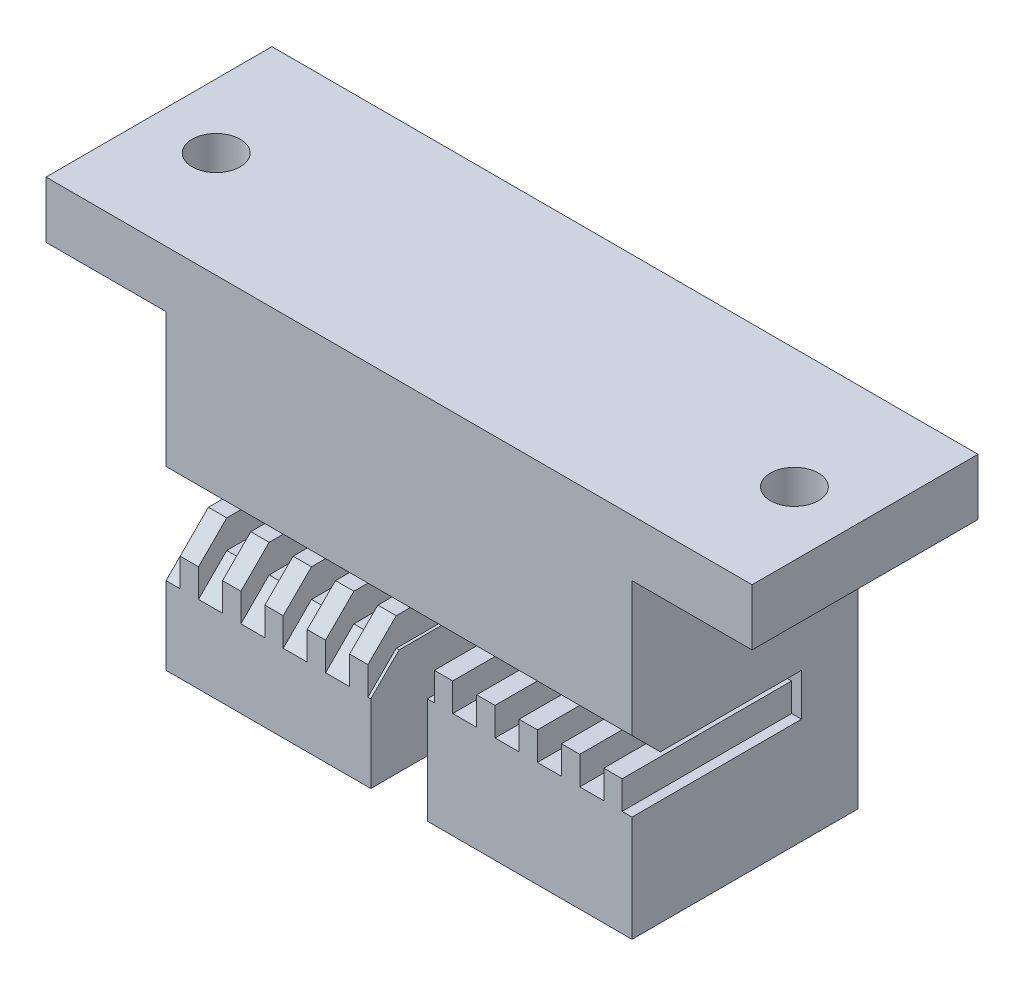
from build123d import *

# Parameters (mm, degrees)
SKETCH1_W            = 50
SKETCH1_H            = 26
BOSS_EXTRUDE1_DEPTH  = 16
SKETCH2_W            = 8.5
SKETCH2_H            = 22
CUT_EXTRUDE1_DEPTH   = 59.583274064
SKETCH3_W            = 8.5
SKETCH3_H            = 22
CUT_EXTRUDE2_DEPTH   = 59.583274064
SKETCH4_W            = 12
SKETCH4_H            = 10.5
CUT_EXTRUDE3_DEPTH   = 52.217672731
SKETCH5_W            = 14.5
SKETCH5_H            = 7.5
BOSS_EXTRUDE2_DEPTH  = 12
SKETCH6_W            = 1.3
SKETCH6_H            = 2
BOSS_EXTRUDE3_DEPTH  = 12
SKETCH7_W            = 1.3
SKETCH7_H            = 2
BOSS_EXTRUDE4_DEPTH  = 12
SKETCH8_W            = 1.3
SKETCH8_H            = 2
BOSS_EXTRUDE5_DEPTH  = 12
SKETCH9_W            = 1.3
SKETCH9_H            = 2
BOSS_EXTRUDE6_DEPTH  = 12
SKETCH10_W           = 1.3
SKETCH10_H           = 2
BOSS_EXTRUDE7_DEPTH  = 12
SKETCH11_W           = 14.5
SKETCH11_H           = 7.5
BOSS_EXTRUDE8_DEPTH  = 12
SKETCH12_W           = 1.3
SKETCH12_H           = 2
BOSS_EXTRUDE9_DEPTH  = 12
SKETCH13_W           = 1.3
SKETCH13_H           = 2
BOSS_EXTRUDE10_DEPTH = 12
SKETCH14_W           = 1.3
SKETCH14_H           = 2
BOSS_EXTRUDE11_DEPTH = 12
SKETCH15_W           = 1.3
SKETCH15_H           = 2
BOSS_EXTRUDE12_DEPTH = 12
SKETCH16_W           = 1.3
SKETCH16_H           = 2
BOSS_EXTRUDE13_DEPTH = 12
SKETCH17_R           = 1.7
CUT_EXTRUDE4_DEPTH   = 59.318093247
SKETCH18_R           = 1.7
CUT_EXTRUDE5_DEPTH   = 59.318093247
CHAMFER2_SIZE        = 2


with BuildPart() as part:
    # Sketch1 → Boss-Extrude1 (new body)
    with BuildSketch(Plane(origin=(0, 0, -1), x_dir=(-1, 0, 0), z_dir=(0, 0, -1))):
        with Locations((25, 13)):
            Rectangle(SKETCH1_W, SKETCH1_H)
    extrude(amount=-BOSS_EXTRUDE1_DEPTH)

    # Sketch2 → Cut-Extrude1 (cut, through all)
    with BuildSketch(Plane(origin=(0, 0, -1), x_dir=(-1, 0, 0), z_dir=(0, 0, -1))):
        with Locations((45.75, 11)):
            Rectangle(SKETCH2_W, SKETCH2_H)
    extrude(amount=-CUT_EXTRUDE1_DEPTH, mode=Mode.SUBTRACT)

    # Sketch3 → Cut-Extrude2 (cut, through all)
    with BuildSketch(Plane(origin=(0, 0, -1), x_dir=(-1, 0, 0), z_dir=(0, 0, -1))):
        with Locations((4.25, 11)):
            Rectangle(SKETCH3_W, SKETCH3_H)
    extrude(amount=-CUT_EXTRUDE2_DEPTH, mode=Mode.SUBTRACT)

    # Sketch4 → Cut-Extrude3 (cut, through all)
    with BuildSketch(Plane.ZY.offset(41.5)):
        with Locations((9, 5.25)):
            Rectangle(SKETCH4_W, SKETCH4_H)
    extrude(amount=-CUT_EXTRUDE3_DEPTH, mode=Mode.SUBTRACT)

    # Sketch5 → Boss-Extrude2 (add)
    with BuildSketch(Plane.XY.offset(3)):
        with Locations((-15.75, 3.75)):
            Rectangle(SKETCH5_W, SKETCH5_H)
    extrude(amount=BOSS_EXTRUDE2_DEPTH)

    # Sketch6 → Boss-Extrude3 (add)
    with BuildSketch(Plane.XY.offset(3)):
        with Locations((-9.85, 8.5)):
            Rectangle(SKETCH6_W, SKETCH6_H)
    extrude(amount=BOSS_EXTRUDE3_DEPTH)

    # Sketch7 → Boss-Extrude4 (add)
    with BuildSketch(Plane.XY.offset(3)):
        with Locations((-12.85, 8.5)):
            Rectangle(SKETCH7_W, SKETCH7_H)
    extrude(amount=BOSS_EXTRUDE4_DEPTH)

    # Sketch8 → Boss-Extrude5 (add)
    with BuildSketch(Plane.XY.offset(3)):
        with Locations((-15.85, 8.5)):
            Rectangle(SKETCH8_W, SKETCH8_H)
    extrude(amount=BOSS_EXTRUDE5_DEPTH)

    # Sketch9 → Boss-Extrude6 (add)
    with BuildSketch(Plane.XY.offset(3)):
        with Locations((-18.85, 8.5)):
            Rectangle(SKETCH9_W, SKETCH9_H)
    extrude(amount=BOSS_EXTRUDE6_DEPTH)

    # Sketch10 → Boss-Extrude7 (add)
    with BuildSketch(Plane.XY.offset(3)):
        with Locations((-21.85, 8.5)):
            Rectangle(SKETCH10_W, SKETCH10_H)
    extrude(amount=BOSS_EXTRUDE7_DEPTH)

    # Sketch11 → Boss-Extrude8 (add)
    with BuildSketch(Plane.XY.offset(3)):
        with Locations((-34.25, 3.75)):
            Rectangle(SKETCH11_W, SKETCH11_H)
    extrude(amount=BOSS_EXTRUDE8_DEPTH)

    # Sketch12 → Boss-Extrude9 (add)
    with BuildSketch(Plane.XY.offset(3)):
        with Locations((-27.85, 8.5)):
            Rectangle(SKETCH12_W, SKETCH12_H)
    extrude(amount=BOSS_EXTRUDE9_DEPTH)

    # Sketch13 → Boss-Extrude10 (add)
    with BuildSketch(Plane.XY.offset(3)):
        with Locations((-30.85, 8.5)):
            Rectangle(SKETCH13_W, SKETCH13_H)
    extrude(amount=BOSS_EXTRUDE10_DEPTH)

    # Sketch14 → Boss-Extrude11 (add)
    with BuildSketch(Plane.XY.offset(3)):
        with Locations((-33.85, 8.5)):
            Rectangle(SKETCH14_W, SKETCH14_H)
    extrude(amount=BOSS_EXTRUDE11_DEPTH)

    # Sketch15 → Boss-Extrude12 (add)
    with BuildSketch(Plane.XY.offset(3)):
        with Locations((-36.85, 8.5)):
            Rectangle(SKETCH15_W, SKETCH15_H)
    extrude(amount=BOSS_EXTRUDE12_DEPTH)

    # Sketch16 → Boss-Extrude13 (add)
    with BuildSketch(Plane.XY.offset(3)):
        with Locations((-39.85, 8.5)):
            Rectangle(SKETCH16_W, SKETCH16_H)
    extrude(amount=BOSS_EXTRUDE13_DEPTH)

    # Sketch17 → Cut-Extrude4 (cut, through all)
    with BuildSketch(Plane(origin=(0, 26, 0), x_dir=(-1, 0, 0), z_dir=(0, 1, 0))):
        with Locations(Location((4.5, 7.5, 0), (0, 0, 90))):
            Circle(SKETCH17_R)
    extrude(amount=-CUT_EXTRUDE4_DEPTH, mode=Mode.SUBTRACT)

    # Sketch18 → Cut-Extrude5 (cut, through all)
    with BuildSketch(Plane(origin=(0, 26, 0), x_dir=(-1, 0, 0), z_dir=(0, 1, 0))):
        with Locations(Location((45.449445698, 7.5, 0), (0, 0, 90))):
            Circle(SKETCH18_R)
    extrude(amount=-CUT_EXTRUDE5_DEPTH, mode=Mode.SUBTRACT)

    # Chamfer2
    chamfer2_edges = [part.edges().sort_by_distance(p)[0] for p in [
        (-39.85, 9.5, 15),
        (-38.35, 7.5, 15),
        (-36.85, 9.5, 15),
        (-35.35, 7.5, 15),
        (-33.85, 9.5, 15),
        (-32.35, 7.5, 15),
        (-30.85, 9.5, 15),
        (-29.35, 7.5, 15),
        (-27.85, 9.5, 15),
        (-27.1, 7.5, 15),
        (-41, 7.5, 15),
        (-25, 10.5, 15),
    ]]
    chamfer(chamfer2_edges, length=CHAMFER2_SIZE - 0.0001)  # a hair under: the kernel refuses the full size


solid = part.part
